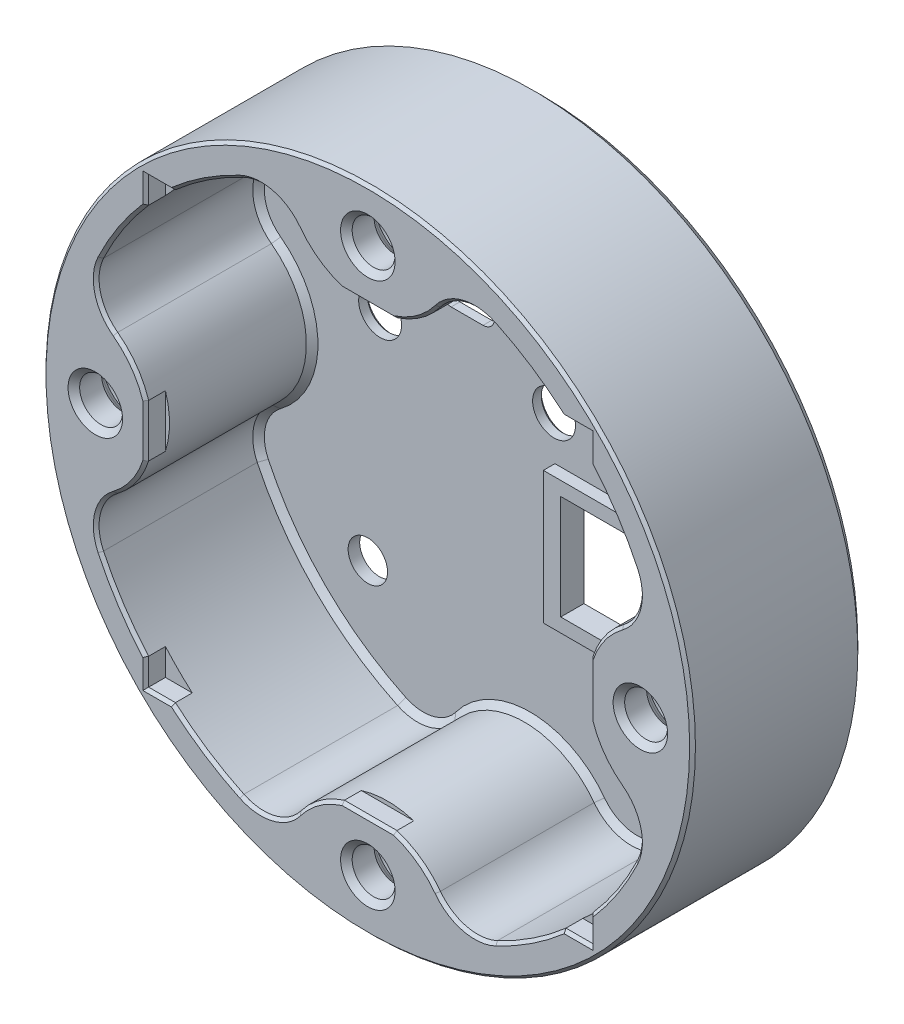
from build123d import *

# Parameters (mm, degrees)
SKETCH1_R      = 28
EXTRUDE1_DEPTH = 1
SKETCH2_R      = 28
SKETCH2_R_2    = 25.5
EXTRUDE2_DEPTH = 14
EXTRUDE3_START = -14
SKETCH3_R      = 1.85
EXTRUDE3_DEPTH = 14
SKETCH5_W      = 38.3
SKETCH5_H      = 38.3
EXTRUDE7_DEPTH = 1.7
SKETCH_R       = 1.85
EXTRUDE4_DEPTH = 43.343830719
EXTRUDE5_START = -15
SKETCH_2_R     = 3.075
EXTRUDE5_DEPTH = 12
CHAMFER1_SIZE  = 0.6125
CHAMFER2_SIZE  = 0.75
CHAMFER3_SIZE  = 0.5
FILLET1_R      = 4
SKETCH4_R      = 1.7
SKETCH4_R_2    = 1.85
SKETCH4_W      = 4.75
SKETCH4_H      = 10
EXTRUDE6_DEPTH = 10
FILLET2_R      = 1
CHAMFER4_SIZE  = 0.5
CHAMFER5_SIZE  = 0.25
CHAMFER6_SIZE  = 0.5
SKETCH_3_W     = 14
SKETCH_3_H     = 9
EXTRUDE8_DEPTH = 43.000000033
SKETCH6_W      = 17
SKETCH6_H      = 11.4
SKETCH6_W_2    = 14
SKETCH6_H_2    = 9
EXTRUDE9_DEPTH = 1


with BuildPart() as part:
    # Sketch1 → Extrude1 (new body)
    with BuildSketch(Plane.XY):
        Circle(SKETCH1_R)
    extrude(amount=EXTRUDE1_DEPTH)

    # Sketch2 → Extrude2 (add)
    with BuildSketch(Plane.XY.offset(1)):
        Circle(SKETCH2_R)
        Circle(SKETCH2_R_2, mode=Mode.SUBTRACT)
    extrude(amount=EXTRUDE2_DEPTH)

    # Sketch3 → Extrude3 (add)
    # profile 1 of 4: a face of its own
    with BuildSketch(Plane.XY.offset(15).offset(EXTRUDE3_START)):
        with BuildLine():
            ThreePointArc((24.442775665, 7.26641024), (18.8, 0), (24.442775665, -7.26641024))
            ThreePointArc((24.442775665, -7.26641024), (25.5, 0), (24.442775665, 7.26641024))
        make_face()
        with Locations((23.5, 0)):
            Circle(SKETCH3_R, mode=Mode.SUBTRACT)
    # profile 2 of 4: a face of its own
    with BuildSketch(Plane.XY.offset(15).offset(EXTRUDE3_START)):
        with BuildLine():
            ThreePointArc((-7.26641024, 24.442775665), (0, 18.8), (7.26641024, 24.442775665))
            ThreePointArc((7.26641024, 24.442775665), (0, 25.5), (-7.26641024, 24.442775665))
        make_face()
        with Locations((0, 23.5)):
            Circle(SKETCH3_R, mode=Mode.SUBTRACT)
    # profile 3 of 4: a face of its own
    with BuildSketch(Plane.XY.offset(15).offset(EXTRUDE3_START)):
        with BuildLine():
            ThreePointArc((7.26641024, -24.442775665), (0, -18.8), (-7.26641024, -24.442775665))
            ThreePointArc((-7.26641024, -24.442775665), (0, -25.5), (7.26641024, -24.442775665))
        make_face()
        with Locations((0, -23.5)):
            Circle(SKETCH3_R, mode=Mode.SUBTRACT)
    # profile 4 of 4: a face of its own
    with BuildSketch(Plane.XY.offset(15).offset(EXTRUDE3_START)):
        with BuildLine():
            ThreePointArc((-24.442775665, -7.26641024), (-18.8, 0), (-24.442775665, 7.26641024))
            ThreePointArc((-24.442775665, 7.26641024), (-25.5, 0), (-24.442775665, -7.26641024))
        make_face()
        with Locations((-23.5, 0)):
            Circle(SKETCH3_R, mode=Mode.SUBTRACT)
    extrude(amount=EXTRUDE3_DEPTH)

    # Sketch5 → Extrude7 (cut)
    with BuildSketch(Plane.XY.offset(15)):
        Rectangle(SKETCH5_W, SKETCH5_H)
    extrude(amount=-EXTRUDE7_DEPTH, mode=Mode.SUBTRACT)

    # Sketch → Extrude4 (cut, through all)
    with BuildSketch(Plane.XY.offset(15)):
        with Locations((-23.5, 0)):
            Circle(SKETCH_R)
        with Locations((0, 23.5)):
            Circle(SKETCH_R)
        with Locations((23.5, 0)):
            Circle(SKETCH_R)
        with Locations((0, -23.5)):
            Circle(SKETCH_R)
    extrude(amount=-EXTRUDE4_DEPTH, mode=Mode.SUBTRACT)

    # Sketch 2 → Extrude5 (cut)
    with BuildSketch(Plane.XY.offset(15).offset(EXTRUDE5_START)):
        with Locations(Location((23.5, 0, 0), (0, 0, 180))):
            Circle(SKETCH_2_R)
        with Locations(Location((0, -23.5, 0), (0, 0, 180))):
            Circle(SKETCH_2_R)
        with Locations(Location((-23.5, 0, 0), (0, 0, 180))):
            Circle(SKETCH_2_R)
        with Locations(Location((0, 23.5, 0), (0, 0, 180))):
            Circle(SKETCH_2_R)
    extrude(amount=EXTRUDE5_DEPTH, mode=Mode.SUBTRACT)

    # Chamfer1
    chamfer1_edges = [part.edges().sort_by_distance(p)[0] for p in [
        (-25.35, 0, 12),
        (-20.425, 0, 12),
        (-1.85, 23.5, 12),
        (3.075, 23.5, 12),
        (21.65, 0, 12),
        (26.575, 0, 12),
        (-1.85, -23.5, 12),
        (3.075, -23.5, 12),
    ]]
    chamfer(chamfer1_edges, length=CHAMFER1_SIZE - 0.0001)  # a hair under: the kernel refuses the full size

    # Chamfer2
    chamfer2_edges = [part.edges().sort_by_distance(p)[0] for p in [
        (-28, 0, 0),
    ]]
    chamfer(chamfer2_edges, length=CHAMFER2_SIZE)

    # Chamfer3
    chamfer3_edges = [part.edges().sort_by_distance(p)[0] for p in [
        (-20.425, 0, 0),
        (3.075, 23.5, 0),
        (26.575, 0, 0),
        (3.075, -23.5, 0),
    ]]
    chamfer(chamfer3_edges, length=CHAMFER3_SIZE)

    # Fillet1
    fillet1_edges = [part.edges().sort_by_distance(p)[0] for p in [
        (7.26641024, 24.442775665, 8),
        (-7.26641024, 24.442775665, 8),
        (-24.442775665, 7.26641024, 8),
        (-24.442775665, -7.26641024, 8),
        (7.26641024, -24.442775665, 8),
        (-7.26641024, -24.442775665, 8),
        (24.442775665, -7.26641024, 8),
        (24.442775665, 7.26641024, 8),
    ]]
    fillet(fillet1_edges, radius=FILLET1_R)

    # Sketch4 → Extrude6 (cut)
    with BuildSketch(Plane.XY.offset(1)):
        with Locations((-14, 14)):
            Circle(SKETCH4_R)
        with Locations((-12.941817988, 5.036547952)):
            Circle(SKETCH4_R_2)
        with Locations((-14, -14)):
            Circle(SKETCH4_R)
        with Locations((2.058182012, 5.036547952)):
            Circle(SKETCH4_R_2)
        with Locations((-5.441817988, 13.536547952)):
            Rectangle(SKETCH4_W, SKETCH4_H)
        with Locations((14, 14)):
            Circle(SKETCH4_R)
        with Locations((14, -14)):
            Circle(SKETCH4_R)
    extrude(amount=-EXTRUDE6_DEPTH, mode=Mode.SUBTRACT)

    # Fillet2
    fillet2_edges = [part.edges().sort_by_distance(p)[0] for p in [
        (-3.066817988, 8.536547952, 0.5),
        (-7.816817988, 8.536547952, 0.5),
        (-7.816817988, 18.536547952, 0.5),
        (-3.066817988, 18.536547952, 0.5),
    ]]
    fillet(fillet2_edges, radius=FILLET2_R)

    # Chamfer4
    chamfer4_edges = [part.edges().sort_by_distance(p)[0] for p in [
        (-18.8, 0, 1),
        (-18.03122292, 18.03122292, 1),
        (18.8, 0, 1),
        (18.03122292, 18.03122292, 1),
        (0, 18.8, 1),
        (-18.03122292, -18.03122292, 1),
        (0, -18.8, 1),
        (18.03122292, -18.03122292, 1),
        (8.253789067, 23.305868132, 1),
        (-8.253789067, 23.305868132, 1),
        (23.305868132, 8.253789067, 1),
        (23.305868132, -8.253789067, 1),
        (8.253789067, -23.305868132, 1),
        (-8.253789067, -23.305868132, 1),
        (-23.305868132, -8.253789067, 1),
        (-23.305868132, 8.253789067, 1),
    ]]
    chamfer(chamfer4_edges, length=CHAMFER4_SIZE)

    # Chamfer5
    chamfer5_edges = [part.edges().sort_by_distance(p)[0] for p in [
        (19.15, 0, 15),
        (-20.188472135, -4.347324137, 15),
        (-14.020878865, 21.299412101, 15),
        (-21.299412101, -14.020878865, 15),
        (4.347324137, -20.188472135, 15),
        (14.020878865, -21.299412101, 15),
        (20.188472135, 4.347324137, 15),
        (21.299412101, 14.020878865, 15),
        (-4.347324137, 20.188472135, 15),
        (-23.305868132, 8.253789067, 15),
        (-23.305868132, -8.253789067, 15),
        (-8.253789067, -23.305868132, 15),
        (8.253789067, -23.305868132, 15),
        (23.305868132, -8.253789067, 15),
        (23.305868132, 8.253789067, 15),
        (-8.253789067, 23.305868132, 15),
        (8.253789067, 23.305868132, 15),
        (0.208182012, 5.036547952, 0),
        (-14.791817988, 5.036547952, 0),
        (-3.066817988, 13.536547952, 0),
        (-5.441817988, 8.536547952, 0),
        (-7.816817988, 13.536547952, 0),
        (-5.441817988, 18.536547952, 0),
        (-3.359711207, 8.829441171, 0),
        (-7.523924769, 8.829441171, 0),
        (-7.523924769, 18.243654733, 0),
        (-3.359711207, 18.243654733, 0),
        (20.188472135, -4.347324137, 15),
        (-28, 0, 15),
        (-4.347324137, -20.188472135, 15),
        (-20.188472135, 4.347324137, 15),
        (4.347324137, 20.188472135, 15),
        (14.020878865, 21.299412101, 15),
        (-21.299412101, 14.020878865, 15),
        (21.299412101, -14.020878865, 15),
        (-14.020878865, -21.299412101, 15),
        (19.15, -17.994137426, 15),
        (17.994137426, -19.15, 15),
        (-17.994137426, -19.15, 15),
        (-19.15, -17.994137426, 15),
        (-19.15, 17.994137426, 15),
        (-17.994137426, 19.15, 15),
        (17.994137426, 19.15, 15),
        (19.15, 17.994137426, 15),
        (0, 19.15, 15),
        (-19.15, 0, 15),
        (0, -19.15, 15),
    ]]
    chamfer(chamfer5_edges, length=CHAMFER5_SIZE)

    # Chamfer6
    chamfer6_edges = [part.edges().sort_by_distance(p)[0] for p in [
        (-1.85, 23.5, 15),
        (-25.35, 0, 15),
        (-1.85, -23.5, 15),
        (21.65, 0, 15),
    ]]
    chamfer(chamfer6_edges, length=CHAMFER6_SIZE)

    # Sketch 3 → Extrude8 (cut, through all)
    with BuildSketch(Plane.XY.offset(1)):
        with Locations((10.634663912, -4.392578572)):
            Rectangle(SKETCH_3_W, SKETCH_3_H)
    extrude(amount=-EXTRUDE8_DEPTH, mode=Mode.SUBTRACT)

    # Sketch6 → Extrude9 (add)
    with BuildSketch(Plane.XY.offset(1)):
        with Locations((10.634663912, -4.392578572)):
            Rectangle(SKETCH6_W, SKETCH6_H)
        with Locations((10.634663912, -4.392578572)):
            Rectangle(SKETCH6_W_2, SKETCH6_H_2, mode=Mode.SUBTRACT)
    extrude(amount=EXTRUDE9_DEPTH)


solid = part.part
